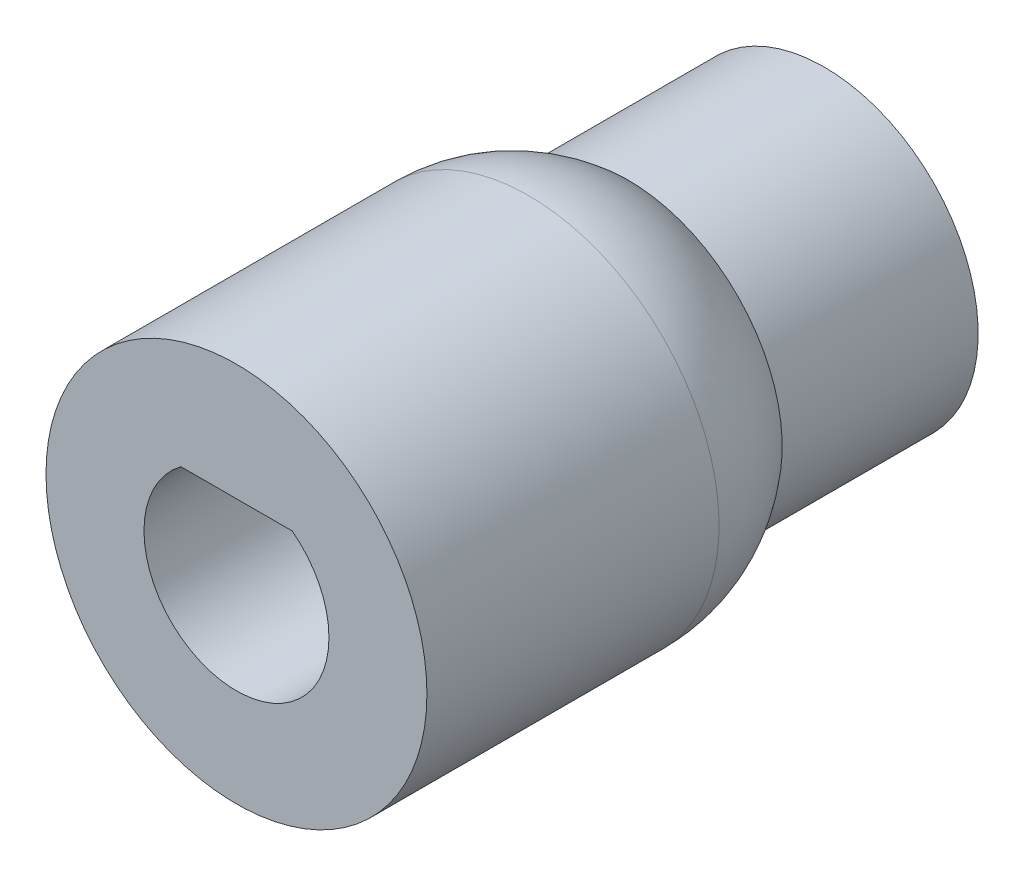
from build123d import *

# Parameters (mm, degrees)
SKETCH1_R           = 6.1722
BOSS_EXTRUDE1_DEPTH = 12.7
SKETCH2_R           = 4.985
SKETCH2_R_2         = 1.985
BOSS_EXTRUDE2_DEPTH = 6.35
FILLET1_R           = 5


with BuildPart() as part:
    # Sketch1 → Boss-Extrude1 (new body)
    with BuildSketch(Plane.XY):
        Circle(SKETCH1_R)
        with BuildLine():
            Line((-1.8034, 2.393941578), (1.8034, 2.393941578))
            ThreePointArc((1.8034, 2.393941578), (0, -2.9972), (-1.8034, 2.393941578))
        make_face(mode=Mode.SUBTRACT)
    extrude(amount=BOSS_EXTRUDE1_DEPTH)

    # Sketch2 → Boss-Extrude2 (add)
    with BuildSketch(Plane(origin=(0, 0, 0), x_dir=(-1, 0, 0), z_dir=(0, 0, -1))):
        Circle(SKETCH2_R)
        Circle(SKETCH2_R_2, mode=Mode.SUBTRACT)
    extrude(amount=BOSS_EXTRUDE2_DEPTH)

    # Fillet1
    # the kernel refuses this fillet: 5 mm, written as the material it takes off along each edge
    with BuildSketch(Plane(origin=(0, 0, 0), x_dir=(1, 0, 0), z_dir=(0, -1, 0))) as fillet1_piece_1_section:
        with BuildLine():
            CenterArc((1.1722, 3.234587479), FILLET1_R, 319.690404577, 40.309595423)
            Line((4.985, 0), (5.061256, -0.06469175))
            ThreePointArc((5.061256, -0.06469175), (5.5786, -0.1), (6.1722, -0.1))
            Line((6.1722, -0.1), (6.2722, 0))
            Line((6.2722, 0), (6.2722, 3.234587479))
            Line((6.2722, 3.234587479), (6.1722, 3.234587479))
        make_face()
    fillet1_piece_1 = revolve(axis=Axis((0, 0, 0), (0, 0, 1)), mode=Mode.PRIVATE)
    fillet1_piece_1 = fillet1_piece_1 - Plane(origin=(0, 0, 1.498233037), x_dir=(-1, 0, 0), z_dir=(0, 0, 1)) * Cylinder(4.985, 26, mode=Mode.PRIVATE)
    add(fillet1_piece_1, mode=Mode.SUBTRACT)


solid = part.part
